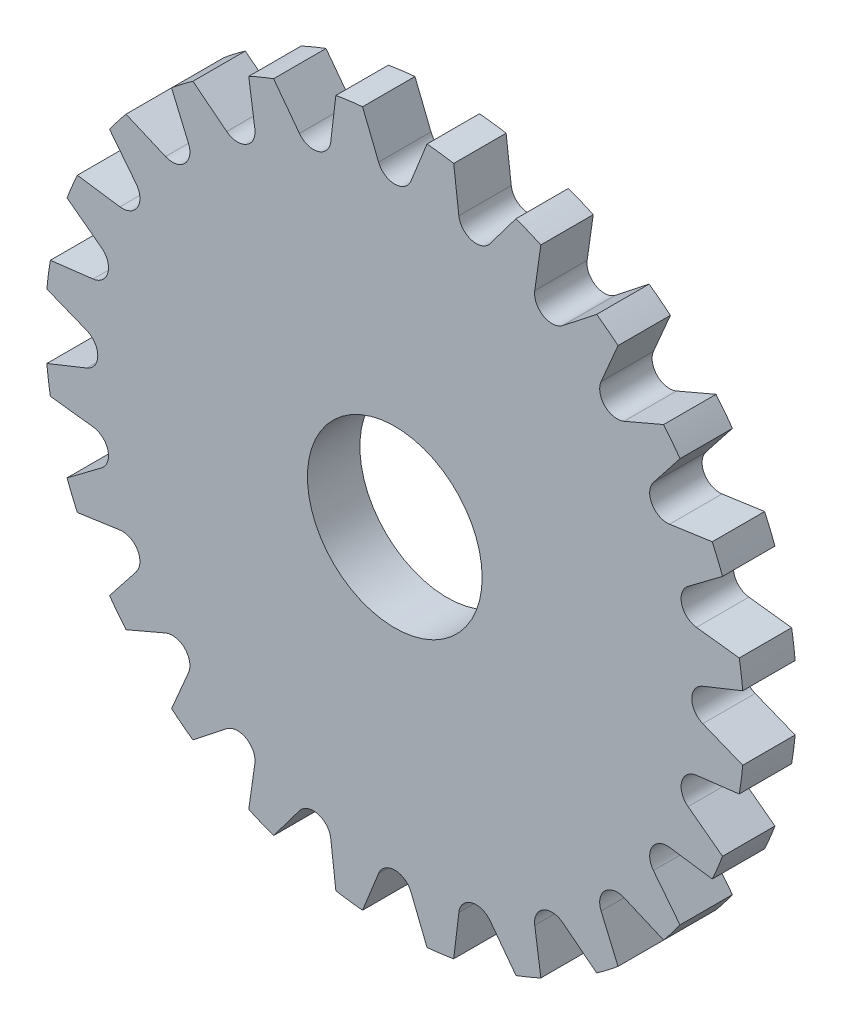
from build123d import *

# Parameters (mm, degrees)
SKETCH1_R           = 40
SKETCH1_R_2         = 10
BOSS_EXTRUDE1_DEPTH = 6
CUT_EXTRUDE1_START  = -6
CUT_EXTRUDE1_DEPTH  = 6
CIRPATTERN1_DEPTH   = 6


# Read off the part's stored shape, not the designer's step: CirPattern1
with BuildPart() as part:
    # Sketch1 → Boss-Extrude1 (new body)
    with BuildSketch(Plane.XY):
        Circle(SKETCH1_R)
        Circle(SKETCH1_R_2, mode=Mode.SUBTRACT)
    extrude(amount=BOSS_EXTRUDE1_DEPTH)

    # Sketch2 → Cut-Extrude1 (cut)
    with BuildSketch(Plane.XY.offset(6).offset(CUT_EXTRUDE1_START)):
        with BuildLine():
            Line((-3.690328017, 39.829404705), (-1.856322788, 35.255644098))
            ThreePointArc((-1.856322788, 35.255644098), (0, 34), (1.856322788, 35.255644098))
            Line((1.856322788, 35.255644098), (3.690328017, 39.829404705))
            ThreePointArc((3.690328017, 39.829404705), (0, 40), (-3.690328017, 39.829404705))
        make_face()
    extrude(amount=CUT_EXTRUDE1_DEPTH, mode=Mode.SUBTRACT)

    # CirPattern1 outline → CirPattern1 (cut)
    with BuildSketch(Plane.XY):
        with BuildLine():
            ThreePointArc((-10.917902263, 33.573885466), (-8.799847534, 32.841478094), (-7.331762018, 34.534788848))
            Line((-7.331762018, 34.534788848), (-6.744025354, 39.427377824))
            ThreePointArc((-6.744025354, 39.427377824), (-10.352761804, 38.637033052), (-13.873191632, 37.517123477))
            Line((-13.873191632, 37.517123477), (-10.917902263, 33.573885466))
        make_face()
        with BuildLine():
            Line((10.917902263, 33.573885466), (13.873191632, 37.517123477))
            ThreePointArc((13.873191632, 37.517123477), (10.352761804, 38.637033052), (6.744025354, 39.427377824))
            Line((6.744025354, 39.427377824), (7.331762018, 34.534788848))
            ThreePointArc((7.331762018, 34.534788848), (8.799847534, 32.841478094), (10.917902263, 33.573885466))
        make_face()
        with BuildLine():
            Line((19.235444741, 29.604122022), (23.110620163, 32.648112284))
            ThreePointArc((23.110620163, 32.648112284), (20, 34.641016152), (16.718784541, 36.338440301))
            Line((16.718784541, 36.338440301), (16.020199358, 31.46044481))
            ThreePointArc((16.020199358, 31.46044481), (17, 29.444863729), (19.235444741, 29.604122022))
        make_face()
        with BuildLine():
            Line((26.242123448, 23.616886586), (30.773098123, 25.554186192))
            ThreePointArc((30.773098123, 25.554186192), (28.284271248, 28.284271248), (25.554186192, 30.773098123))
            Line((25.554186192, 30.773098123), (23.616886586, 26.242123448))
            ThreePointArc((23.616886586, 26.242123448), (24.04163056, 24.04163056), (26.242123448, 23.616886586))
        make_face()
        with BuildLine():
            Line((31.46044481, 16.020199358), (36.338440301, 16.718784541))
            ThreePointArc((36.338440301, 16.718784541), (34.641016152, 20), (32.648112284, 23.110620163))
            Line((32.648112284, 23.110620163), (29.604122022, 19.235444741))
            ThreePointArc((29.604122022, 19.235444741), (29.444863729, 17), (31.46044481, 16.020199358))
        make_face()
        with BuildLine():
            Line((34.534788848, 7.331762018), (39.427377824, 6.744025354))
            ThreePointArc((39.427377824, 6.744025354), (38.637033052, 10.352761804), (37.517123477, 13.873191632))
            Line((37.517123477, 13.873191632), (33.573885466, 10.917902263))
            ThreePointArc((33.573885466, 10.917902263), (32.841478094, 8.799847534), (34.534788848, 7.331762018))
        make_face()
        with BuildLine():
            Line((35.255644098, -1.856322788), (39.829404705, -3.690328017))
            ThreePointArc((39.829404705, -3.690328017), (40, 0), (39.829404705, 3.690328017))
            Line((39.829404705, 3.690328017), (35.255644098, 1.856322788))
            ThreePointArc((35.255644098, 1.856322788), (34, 0), (35.255644098, -1.856322788))
        make_face()
        with BuildLine():
            Line((33.573885466, -10.917902263), (37.517123477, -13.873191632))
            ThreePointArc((37.517123477, -13.873191632), (38.637033052, -10.352761804), (39.427377823, -6.744025354))
            Line((39.427377823, -6.744025354), (34.534788848, -7.331762018))
            ThreePointArc((34.534788848, -7.331762018), (32.841478094, -8.799847534), (33.573885466, -10.917902263))
        make_face()
        with BuildLine():
            Line((29.604122022, -19.235444741), (32.648112283, -23.110620163))
            ThreePointArc((32.648112283, -23.110620163), (34.641016152, -20), (36.3384403, -16.718784541))
            Line((36.3384403, -16.718784541), (31.46044481, -16.020199358))
            ThreePointArc((31.46044481, -16.020199358), (29.444863729, -17), (29.604122022, -19.235444741))
        make_face()
        with BuildLine():
            Line((23.616886586, -26.242123448), (25.554186192, -30.773098123))
            ThreePointArc((25.554186192, -30.773098123), (28.284271247, -28.284271247), (30.773098123, -25.554186192))
            Line((30.773098123, -25.554186192), (26.242123448, -23.616886586))
            ThreePointArc((26.242123448, -23.616886586), (24.04163056, -24.04163056), (23.616886586, -26.242123448))
        make_face()
        with BuildLine():
            Line((16.020199358, -31.46044481), (16.718784541, -36.3384403))
            ThreePointArc((16.718784541, -36.3384403), (20, -34.641016151), (23.110620163, -32.648112283))
            Line((23.110620163, -32.648112283), (19.235444741, -29.604122022))
            ThreePointArc((19.235444741, -29.604122022), (17, -29.444863729), (16.020199358, -31.46044481))
        make_face()
        with BuildLine():
            Line((7.331762018, -34.534788848), (6.744025354, -39.427377823))
            ThreePointArc((6.744025354, -39.427377823), (10.352761804, -38.637033051), (13.873191632, -37.517123476))
            Line((13.873191632, -37.517123476), (10.917902263, -33.573885466))
            ThreePointArc((10.917902263, -33.573885466), (8.799847534, -32.841478094), (7.331762018, -34.534788848))
        make_face()
        with BuildLine():
            Line((-1.856322788, -35.255644098), (-3.690328017, -39.829404705))
            ThreePointArc((-3.690328017, -39.829404705), (0, -40), (3.690328017, -39.829404705))
            Line((3.690328017, -39.829404705), (1.856322788, -35.255644098))
            ThreePointArc((1.856322788, -35.255644098), (0, -34), (-1.856322788, -35.255644098))
        make_face()
        with BuildLine():
            Line((-10.917902263, -33.573885466), (-13.873191632, -37.517123476))
            ThreePointArc((-13.873191632, -37.517123476), (-10.352761804, -38.637033051), (-6.744025354, -39.427377823))
            Line((-6.744025354, -39.427377823), (-7.331762018, -34.534788848))
            ThreePointArc((-7.331762018, -34.534788848), (-8.799847534, -32.841478094), (-10.917902263, -33.573885466))
        make_face()
        with BuildLine():
            Line((-19.235444741, -29.604122022), (-23.110620163, -32.648112283))
            ThreePointArc((-23.110620163, -32.648112283), (-20, -34.641016151), (-16.718784541, -36.3384403))
            Line((-16.718784541, -36.3384403), (-16.020199358, -31.46044481))
            ThreePointArc((-16.020199358, -31.46044481), (-17, -29.444863729), (-19.235444741, -29.604122022))
        make_face()
        with BuildLine():
            Line((-26.242123448, -23.616886586), (-30.773098123, -25.554186192))
            ThreePointArc((-30.773098123, -25.554186192), (-28.284271247, -28.284271247), (-25.554186192, -30.773098123))
            Line((-25.554186192, -30.773098123), (-23.616886586, -26.242123448))
            ThreePointArc((-23.616886586, -26.242123448), (-24.04163056, -24.04163056), (-26.242123448, -23.616886586))
        make_face()
        with BuildLine():
            Line((-31.46044481, -16.020199358), (-36.3384403, -16.718784541))
            ThreePointArc((-36.3384403, -16.718784541), (-34.641016152, -20), (-32.648112283, -23.110620163))
            Line((-32.648112283, -23.110620163), (-29.604122022, -19.235444741))
            ThreePointArc((-29.604122022, -19.235444741), (-29.444863729, -17), (-31.46044481, -16.020199358))
        make_face()
        with BuildLine():
            Line((-34.534788848, -7.331762018), (-39.427377823, -6.744025354))
            ThreePointArc((-39.427377823, -6.744025354), (-38.637033052, -10.352761804), (-37.517123477, -13.873191632))
            Line((-37.517123477, -13.873191632), (-33.573885466, -10.917902263))
            ThreePointArc((-33.573885466, -10.917902263), (-32.841478094, -8.799847534), (-34.534788848, -7.331762018))
        make_face()
        with BuildLine():
            Line((-35.255644098, 1.856322788), (-39.829404705, 3.690328017))
            ThreePointArc((-39.829404705, 3.690328017), (-40, 0), (-39.829404705, -3.690328017))
            Line((-39.829404705, -3.690328017), (-35.255644098, -1.856322788))
            ThreePointArc((-35.255644098, -1.856322788), (-34, 0), (-35.255644098, 1.856322788))
        make_face()
        with BuildLine():
            Line((-33.573885466, 10.917902263), (-37.517123477, 13.873191632))
            ThreePointArc((-37.517123477, 13.873191632), (-38.637033052, 10.352761804), (-39.427377824, 6.744025354))
            Line((-39.427377824, 6.744025354), (-34.534788848, 7.331762018))
            ThreePointArc((-34.534788848, 7.331762018), (-32.841478094, 8.799847534), (-33.573885466, 10.917902263))
        make_face()
        with BuildLine():
            Line((-29.604122022, 19.235444741), (-32.648112284, 23.110620163))
            ThreePointArc((-32.648112284, 23.110620163), (-34.641016152, 20), (-36.338440301, 16.718784541))
            Line((-36.338440301, 16.718784541), (-31.46044481, 16.020199358))
            ThreePointArc((-31.46044481, 16.020199358), (-29.444863729, 17), (-29.604122022, 19.235444741))
        make_face()
        with BuildLine():
            Line((-23.616886586, 26.242123448), (-25.554186192, 30.773098123))
            ThreePointArc((-25.554186192, 30.773098123), (-28.284271248, 28.284271248), (-30.773098123, 25.554186192))
            Line((-30.773098123, 25.554186192), (-26.242123448, 23.616886586))
            ThreePointArc((-26.242123448, 23.616886586), (-24.04163056, 24.04163056), (-23.616886586, 26.242123448))
        make_face()
        with BuildLine():
            Line((-16.020199358, 31.46044481), (-16.718784541, 36.338440301))
            ThreePointArc((-16.718784541, 36.338440301), (-20, 34.641016152), (-23.110620163, 32.648112284))
            Line((-23.110620163, 32.648112284), (-19.235444741, 29.604122022))
            ThreePointArc((-19.235444741, 29.604122022), (-17, 29.444863729), (-16.020199358, 31.46044481))
        make_face()
    extrude(amount=CIRPATTERN1_DEPTH, mode=Mode.SUBTRACT)


solid = part.part
